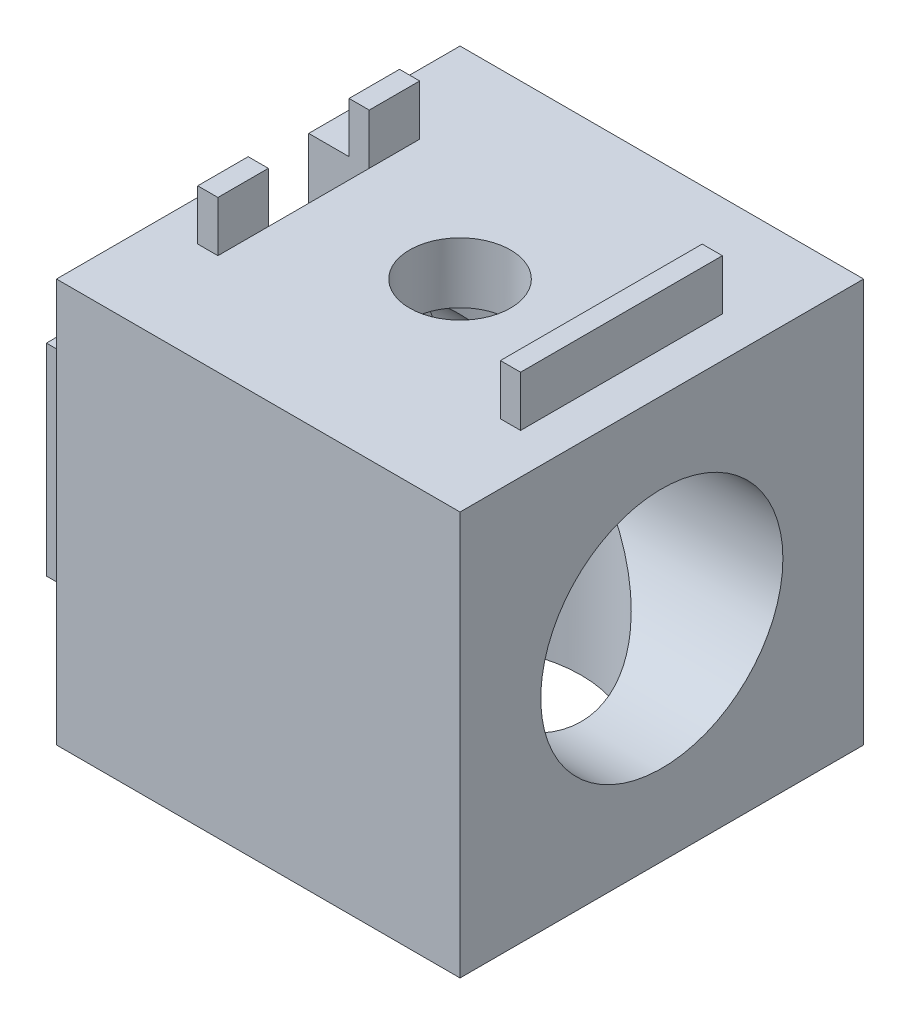
from build123d import *

# Parameters (mm, degrees)
BOSS_EXTRUDE1_DEPTH = 20
SKETCH2_W           = 1
SKETCH2_H           = 2.5
SKETCH2_H_2         = 10
BOSS_EXTRUDE2_DEPTH = 2.5
SKETCH2_3_R         = 2.5
CUT_EXTRUDE1_DEPTH  = 35.641016151
SKETCH3_W           = 1
SKETCH3_H           = 10
BOSS_EXTRUDE3_DEPTH = 2.5
SKETCH5_R           = 6
CUT_EXTRUDE3_DEPTH  = 17
SKETCH7_R           = 6
CUT_EXTRUDE5_DEPTH  = 17


with BuildPart() as part:
    # Sketch1 → Boss-Extrude1 (new body)
    with BuildSketch(Plane(origin=(0, 0, 0), x_dir=(1, 0, 0), z_dir=(0, 1, 0))):
        Polygon((0, 7.5), (3, 7.5), (3, 12.5), (0, 12.5), (0, 20), (20, 20), (20, 0), (0, 0), align=None)
    extrude(amount=BOSS_EXTRUDE1_DEPTH)

    # Sketch2 → Boss-Extrude2 (add)
    with BuildSketch(Plane(origin=(0, 20, 0), x_dir=(1, 0, 0), z_dir=(0, 1, 0))):
        with Locations((2.5, 6.25)):
            Rectangle(SKETCH2_W, SKETCH2_H)
        with Locations((2.5, 13.75)):
            Rectangle(SKETCH2_W, SKETCH2_H)
        with Locations((17.5, 10)):
            Rectangle(SKETCH2_W, SKETCH2_H_2)
    extrude(amount=BOSS_EXTRUDE2_DEPTH)

    # Sketch2<3> → Cut-Extrude1 (cut, through all)
    with BuildSketch(Plane(origin=(0, 20, 0), x_dir=(1, 0, 0), z_dir=(0, 1, 0))):
        with Locations((10, 10)):
            Circle(SKETCH2_3_R)
    extrude(amount=-CUT_EXTRUDE1_DEPTH, mode=Mode.SUBTRACT)

    # Sketch3 → Boss-Extrude3 (add)
    with BuildSketch(Plane.ZY):
        with Locations((-2.5, 10)):
            Rectangle(SKETCH3_W, SKETCH3_H)
        with Locations((-17.5, 10)):
            Rectangle(SKETCH3_W, SKETCH3_H)
    extrude(amount=BOSS_EXTRUDE3_DEPTH)

    # Sketch5 → Cut-Extrude3 (cut)
    with BuildSketch(Plane(origin=(20, 0, 0), x_dir=(0, 0, -1), z_dir=(1, 0, 0))):
        with Locations((10, 10)):
            Circle(SKETCH5_R)
    extrude(amount=-CUT_EXTRUDE3_DEPTH, mode=Mode.SUBTRACT)

    # Sketch7 → Cut-Extrude5 (cut)
    with BuildSketch(Plane.XZ):
        with Locations((10, -10)):
            Circle(SKETCH7_R)
    extrude(amount=-CUT_EXTRUDE5_DEPTH, mode=Mode.SUBTRACT)


solid = part.part
